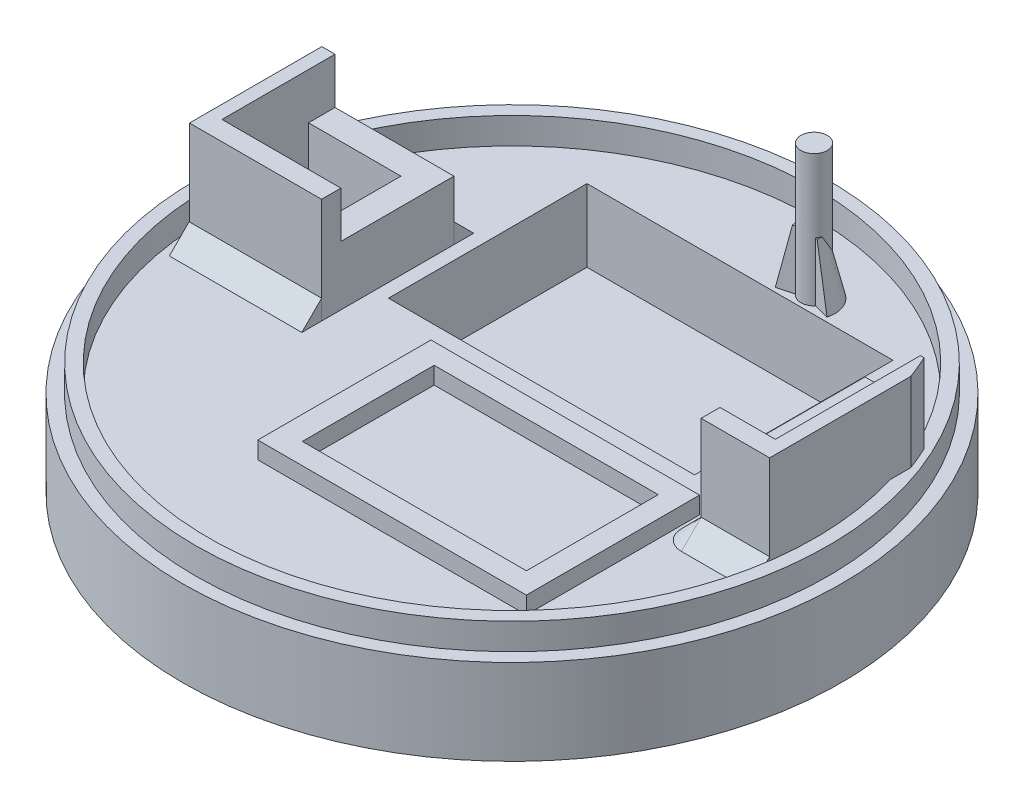
from build123d import *

# Parameters (mm, degrees)
BOSS_EXTRUDE1_DEPTH       = 0.5
BOSS_EXTRUDE1_DEPTH_BACK  = 1
SKETCH1_R                 = 25
SKETCH17_R                = 24
SKETCH17_R_2              = 23
BOSS_EXTRUDE15_DEPTH      = 2
SKETCH2_R                 = 1
BOSS_EXTRUDE2_DEPTH       = 10
SKETCH12_W                = 23.219340148
SKETCH12_H                = 15.058436642
CUT_EXTRUDE2_DEPTH        = 5
SKETCH15_W                = 24.972946701
SKETCH15_H                = 16.75913787
SKETCH15_W_2              = 23.219340148
SKETCH15_H_2              = 15.058436642
BOSS_EXTRUDE13_DEPTH      = 5
BOSS_EXTRUDE14_DEPTH      = 0.0001
BOSS_EXTRUDE14_DEPTH_BACK = 1
SKETCH16_W                = 24.972946701
SKETCH16_H                = 16.75913787
BOSS_EXTRUDE16_DEPTH      = 8
BOSS_EXTRUDE17_DEPTH      = 1.301
BOSS_EXTRUDE18_DEPTH      = 4.5
REVOLVE1_ANGLE            = 195
REVOLVE1_OTHER_WAY_ANGLE  = 15
BOSS_EXTRUDE20_DEPTH      = 7.5
BOSS_EXTRUDE21_DEPTH      = 7.5
BOSS_EXTRUDE22_DEPTH      = 0.0001
BOSS_EXTRUDE22_DEPTH_BACK = 10.05
BOSS_EXTRUDE23_DEPTH      = 0.0001
BOSS_EXTRUDE23_DEPTH_BACK = 5.2001
REVOLVE2_ANGLE            = 90
BOSS_EXTRUDE25_DEPTH      = 12.41001
REVOLVE3_ANGLE            = 90
BOSS_EXTRUDE26_DEPTH      = 3.41001
BOSS_EXTRUDE27_DEPTH      = 0.001
BOSS_EXTRUDE27_DEPTH_BACK = 8.41001
BOSS_EXTRUDE28_DEPTH      = 7.001
BOSS_EXTRUDE29_START      = 5
SKETCH39_R                = 25
SKETCH39_R_2              = 24
SKETCH39_R_3              = 23
SKETCH39_R_4              = 22
BOSS_EXTRUDE29_DEPTH      = 5


# Read off the part's stored shape, not the designer's step: Boss-Extrude18
with BuildPart() as part:
    # Sketch1 → Boss-Extrude1 (new, two sides: drawn at the far end of the back side and taken through both)
    with BuildSketch(Plane(origin=(0, 0, 0), x_dir=(1, 0, 0), z_dir=(0, 1, 0)).offset(-BOSS_EXTRUDE1_DEPTH_BACK)):
        with Locations(Location((0, 0, 0), (0, 0, 270))):
            Circle(SKETCH1_R)
    extrude(amount=BOSS_EXTRUDE1_DEPTH + BOSS_EXTRUDE1_DEPTH_BACK)

    # Sketch17 → Boss-Extrude15 (add)
    with BuildSketch(Plane(origin=(0, 0.5, 0), x_dir=(1, 0, 0), z_dir=(0, 1, 0))):
        with Locations(Location((0, 0, 0), (0, 0, 270))):
            Circle(SKETCH17_R)
        with Locations(Location((0, 0, 0), (0, 0, 270))):
            Circle(SKETCH17_R_2, mode=Mode.SUBTRACT)
    extrude(amount=BOSS_EXTRUDE15_DEPTH)

    # Sketch2 → Boss-Extrude2 (add)
    with BuildSketch(Plane(origin=(0, 0.5, 0), x_dir=(1, 0, 0), z_dir=(0, 1, 0))):
        with Locations(Location((5, 17.917691699, 0), (0, 0, 270))):
            Circle(SKETCH2_R)
    extrude(amount=BOSS_EXTRUDE2_DEPTH)

    # Sketch12 → Cut-Extrude2 (cut)
    with BuildSketch(Plane(origin=(0, 0.5, 0), x_dir=(1, 0, 0), z_dir=(0, 1, 0))):
        with Locations((0.666876956, 9.102631979)):
            Rectangle(SKETCH12_W, SKETCH12_H)
    extrude(amount=-CUT_EXTRUDE2_DEPTH, mode=Mode.SUBTRACT)

    # Sketch15 → Boss-Extrude13 (add)
    with BuildSketch(Plane.XZ.offset(1)):
        with Locations((0.596477735, -9.107727728)):
            Rectangle(SKETCH15_W, SKETCH15_H)
        with Locations((0.666876956, -9.102631979)):
            Rectangle(SKETCH15_W_2, SKETCH15_H_2, mode=Mode.SUBTRACT)
    extrude(amount=BOSS_EXTRUDE13_DEPTH)

    # Sketch3 → Boss-Extrude16 (add)
    with BuildSketch(Plane(origin=(0, 0.5, 0), x_dir=(1, 0, 0), z_dir=(0, 1, 0))):
        Polygon((-11.97807381, -2.465798727), (-11.97807381, -1), (-21, -1), (-21, 7.575525784), (-22, 7.575525784), (-22, -2.465798727), align=None)
        with BuildLine():
            ThreePointArc((22.005108017, 8.247740366), (21.658944991, 9.118119426), (21.278371263, 9.97401205))
            Line((21.278371263, 9.97401205), (21.005108017, 9.97401205))
            Line((21.005108017, 9.97401205), (21.005108017, -1.02598795))
            Line((21.005108017, -1.02598795), (16.80718978, -1.02598795))
            Line((16.80718978, -1.02598795), (16.80718978, -2.458711062))
            Line((16.80718978, -2.458711062), (22.005108017, -2.458711062))
            Line((22.005108017, -2.458711062), (22.005108017, 8.247740366))
        make_face()
    extrude(amount=BOSS_EXTRUDE16_DEPTH)

    # Sketch18 → Boss-Extrude17 (add)
    with BuildSketch(Plane(origin=(0, 0.5, 0), x_dir=(1, 0, 0), z_dir=(0, 1, 0))):
        Polygon((0, -2.402962183), (0, -0.862974972), (-5.282158739, -0.862974972), (-5.282158739, -14.003106764), (0, -14.003106764), (0, -12.402962183), (-3.5, -12.402962183), (-3.5, -2.402962183), align=None)
        Polygon((15.094136196, -0.862974972), (0.201079682, -0.862974972), (0.559908327, -2.402962183), (13.5, -2.402962183), (13.5, -12.402962183), (2.889983811, -12.402962183), (3.262829577, -14.003106764), (15.094136196, -14.003106764), align=None)
        Polygon((2.889983811, -12.402962183), (0, -12.402962183), (0, -14.003106764), (3.262829577, -14.003106764), align=None)
        Polygon((0.201079682, -0.862974972), (0, -0.862974972), (0, -2.402962183), (0.559908327, -2.402962183), align=None)
    extrude(amount=BOSS_EXTRUDE17_DEPTH)

    # Boss-Extrude18 outline → Boss-Extrude18 (add)
    with BuildSketch(Plane(origin=(0, 0.5, 0), x_dir=(1, 0, 0), z_dir=(0, 1, 0))):
        with BuildLine():
            Line((20.724842186, 9.97401205), (18.818512993, 9.97401205))
            Line((18.818512993, 9.97401205), (18.818512993, 9.972233135))
            Line((18.818512993, 9.972233135), (16.80718978, 9.972233135))
            Line((16.80718978, 9.972233135), (16.80718978, -1.02598795))
            Line((16.80718978, -1.02598795), (18.818512993, -1.02598795))
            Line((18.818512993, -1.02598795), (18.818512993, 7.959494075))
            Line((18.818512993, 7.959494075), (21.005108017, 7.959494075))
            Line((21.005108017, 7.959494075), (21.005108017, 9.369388304))
            ThreePointArc((21.005108017, 9.369388304), (20.867165079, 9.672715314), (20.724842186, 9.97401205))
        make_face()
        Polygon((-13.988084857, -1), (-11.97807381, -1), (-11.97807381, 7.575525784), (-21, 7.575525784), (-21, 5.565099869), (-13.988084857, 5.565099869), align=None)
    extrude(amount=BOSS_EXTRUDE18_DEPTH)

    # Sketch22 → Revolve1 (revolve)
    with BuildSketch(Plane(origin=(0, 0, -17.487296663), x_dir=(-1, 0, 0), z_dir=(0, 0, -1))):
        Polygon((-4.976750106, 2.5), (-4.976750106, 4.97103297), (-5.944220353, 4.97103297), (-7.362854562, -1), (-4.976750106, -1), align=None)
    revolve(axis=Axis((4.976750106, 2.5, -17.487296663), (0, 1, 0)), revolution_arc=REVOLVE1_ANGLE)

    # Sketch22 → Revolve1 other way (revolve)
    with BuildSketch(Plane(origin=(0, 0, -17.487296663), x_dir=(-1, 0, 0), z_dir=(0, 0, -1))):
        Polygon((-4.976750106, 2.5), (-4.976750106, 4.97103297), (-5.944220353, 4.97103297), (-7.362854562, -1), (-4.976750106, -1), align=None)
    revolve(axis=Axis((4.976750106, 2.5, -17.487296663), (0, -1, 0)), revolution_arc=REVOLVE1_OTHER_WAY_ANGLE)

    # Sketch23 → Boss-Extrude20 (add)
    with BuildSketch(Plane(origin=(0, 0, 1), x_dir=(-1, 0, 0), z_dir=(0, 0, -1))):
        Polygon((21, 0.5), (21, 2.00493968), (19.5, 0.5), align=None)
    extrude(amount=BOSS_EXTRUDE20_DEPTH)

    # Sketch24 → Boss-Extrude21 (add)
    with BuildSketch(Plane.ZY.offset(13.988084857)):
        Polygon((1, 0.5), (1, 2), (-0.5, 0.5), align=None)
    extrude(amount=BOSS_EXTRUDE21_DEPTH)

    # Sketch25 → Boss-Extrude22 (add, two sides: drawn at the far end of the back side and taken through both)
    with BuildSketch(Plane(origin=(-11.97807381, 0, 0), x_dir=(0, 0, -1), z_dir=(1, 0, 0)).offset(-BOSS_EXTRUDE22_DEPTH_BACK)):
        Polygon((-2.465798727, 0.5), (-3.965798727, 0.5), (-2.465798727, 2), align=None)
    extrude(amount=BOSS_EXTRUDE22_DEPTH + BOSS_EXTRUDE22_DEPTH_BACK)

    # Sketch28 → Boss-Extrude23 (add, two sides: drawn at the far end of the back side and taken through both)
    with BuildSketch(Plane.ZY.offset(-16.80718978).offset(-BOSS_EXTRUDE23_DEPTH_BACK)):
        Polygon((2.458711062, 2.003228909), (2.458711062, 0.5), (3.95259513, 0.5), align=None)
    extrude(amount=BOSS_EXTRUDE23_DEPTH + BOSS_EXTRUDE23_DEPTH_BACK)

    # Sketch30 → Revolve2 (revolve)
    with BuildSketch(Plane.ZY.offset(-16.80708978)):
        Polygon((2.458711062, 2.003228909), (2.458711062, 0.5), (3.95259513, 0.5), align=None)
    revolve(axis=Axis((16.80708978, 2.003228909, 2.458711062), (0, -1, 0)), revolution_arc=REVOLVE2_ANGLE)

    # Sketch31 → Boss-Extrude25 (add)
    with BuildSketch(Plane(origin=(0, 0, 2.458711062), x_dir=(-1, 0, 0), z_dir=(0, 0, -1))):
        Polygon((-16.792249437, 1.988295734), (-16.792249437, 0.5), (-15.313205712, 0.5), align=None)
    extrude(amount=BOSS_EXTRUDE25_DEPTH)

    # Sketch32 → Revolve3 (revolve)
    with BuildSketch(Plane(origin=(0, 0, -9.951298938), x_dir=(-1, 0, 0), z_dir=(0, 0, -1))):
        Polygon((-16.792249437, 1.988295734), (-16.792249437, 0.5), (-15.313205712, 0.5), align=None)
    revolve(axis=Axis((16.792249437, 1.988295734, -9.951298938), (0, -1, 0)), revolution_arc=REVOLVE3_ANGLE)

    # Sketch33 → Boss-Extrude26 (add)
    with BuildSketch(Plane(origin=(16.792249437, 0, 0), x_dir=(0, 0, -1), z_dir=(1, 0, 0))):
        Polygon((9.951298938, 1.988295734), (11.430342663, 0.5), (9.951298938, 0.5), (9.915470666, 0.5), (9.915470666, 1.988295734), align=None)
    extrude(amount=BOSS_EXTRUDE26_DEPTH)

    # Sketch34 → Boss-Extrude27 (add, two sides: drawn at the far end of the back side and taken through both)
    with BuildSketch(Plane(origin=(-11.97807381, 0, 0), x_dir=(0, 0, -1), z_dir=(1, 0, 0)).offset(-BOSS_EXTRUDE27_DEPTH_BACK)):
        Polygon((7.575525784, 0.5), (9.075525784, 0.5), (7.575525784, 2), align=None)
    extrude(amount=BOSS_EXTRUDE27_DEPTH + BOSS_EXTRUDE27_DEPTH_BACK)

    # Sketch37 → Boss-Extrude28 (add)
    with BuildSketch(Plane.XY.offset(-5.565099869)):
        Polygon((-13.988084857, 0.5), (-13.988084857, 2), (-15.488084857, 0.5), align=None)
    extrude(amount=BOSS_EXTRUDE28_DEPTH)


with BuildPart() as body_2:
    # Sketch16 → Boss-Extrude14 (new, two sides: drawn at the far end of the back side and taken through both)
    with BuildSketch(Plane(origin=(0, -6, 0), x_dir=(-1, 0, 0), z_dir=(0, -1, 0)).offset(-BOSS_EXTRUDE14_DEPTH_BACK)):
        with Locations((-0.596477735, 9.107727728)):
            Rectangle(SKETCH16_W, SKETCH16_H)
    extrude(amount=BOSS_EXTRUDE14_DEPTH + BOSS_EXTRUDE14_DEPTH_BACK)


    add(part.part)  # Boss-Extrude29 merges part
    # Sketch39 → Boss-Extrude29 (add)
    # profile 1 of 2: a face of its own
    with BuildSketch(Plane.XZ.offset(1).offset(BOSS_EXTRUDE29_START)):
        with Locations(Location((0, 0, 0), (0, 0, 90))):
            Circle(SKETCH39_R)
        with Locations(Location((0, 0, 0), (0, 0, 90))):
            Circle(SKETCH39_R_2, mode=Mode.SUBTRACT)
    # profile 2 of 2: a face of its own
    with BuildSketch(Plane.XZ.offset(1).offset(BOSS_EXTRUDE29_START)):
        with Locations(Location((0, 0, 0), (0, 0, 90))):
            Circle(SKETCH39_R_3)
        with Locations(Location((0, 0, 0), (0, 0, 270))):
            Circle(SKETCH39_R_4, mode=Mode.SUBTRACT)
    extrude(amount=-BOSS_EXTRUDE29_DEPTH)


solid = body_2.part
